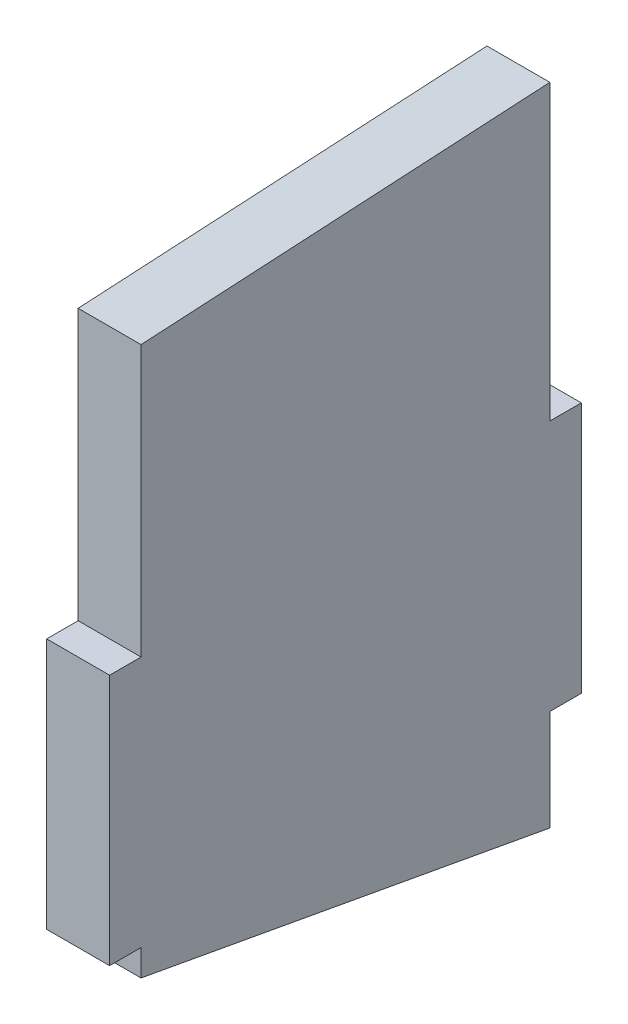
from build123d import *

# Parameters (mm, degrees)
BOSS_EXTRUDE1_DEPTH = 25.4


with BuildPart() as part:
    # Sketch1 → Boss-Extrude1 (new body)
    with BuildSketch(Plane(origin=(0, 0, 0), x_dir=(0, 0, -1), z_dir=(1, 0, 0))):
        Polygon((82.55, 169.255785694), (-82.55, 160.06891278), (-82.55, 50.8), (-95.25, 50.8), (-95.25, -50.8), (-82.55, -50.8), (-82.55, -61.45546637), (82.55, -91.545497884), (82.55, -50.8), (95.25, -50.8), (95.25, 50.8), (82.55, 50.8), align=None)
    extrude(amount=BOSS_EXTRUDE1_DEPTH)


solid = part.part
